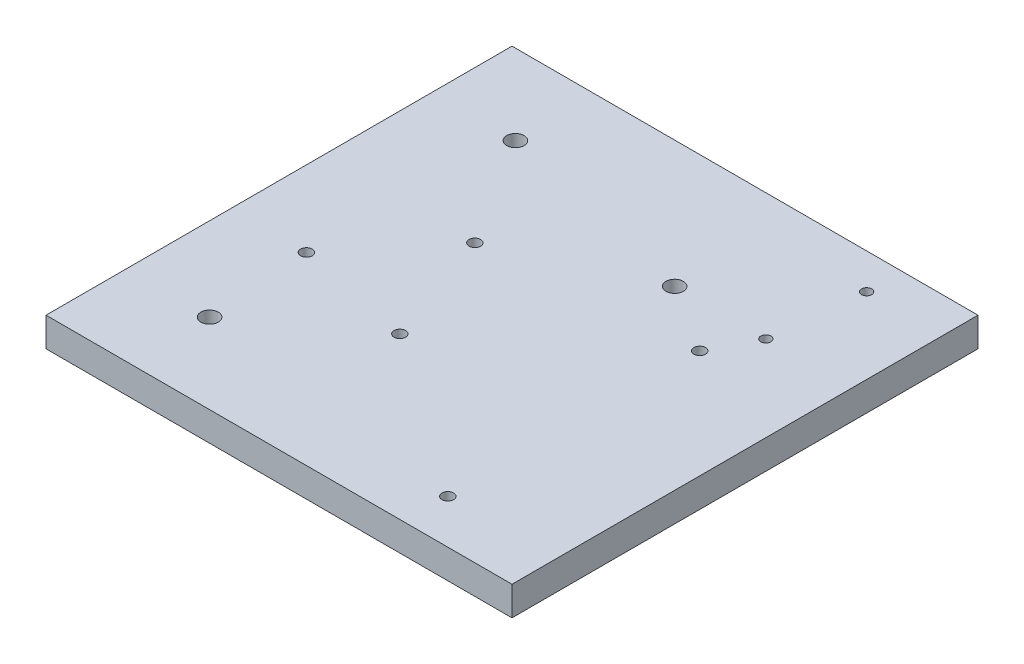
from build123d import *

# Parameters (mm, degrees)
SKETCH1_W           = 101.6
SKETCH1_H           = 101.6
BOSS_EXTRUDE1_DEPTH = 6.35
SKETCH3_R           = 1.27
CUT_EXTRUDE2_DEPTH  = 73.122135992
SKETCH4_R           = 1.27
CUT_EXTRUDE3_DEPTH  = 73.122135992
SKETCH7_R           = 1.89865
CUT_EXTRUDE5_DEPTH  = 73.122135992
SKETCH8_R           = 1.89865
CUT_EXTRUDE6_DEPTH  = 73.122135992
SKETCH10_R          = 1.1
CUT_EXTRUDE7_DEPTH  = 73.122135992


with BuildPart() as part:
    # Sketch1 → Boss-Extrude1 (new body)
    with BuildSketch(Plane(origin=(0, 0, 0), x_dir=(1, 0, 0), z_dir=(0, 1, 0))):
        Rectangle(SKETCH1_W, SKETCH1_H)
    extrude(amount=BOSS_EXTRUDE1_DEPTH)

    # Sketch3 → Cut-Extrude2 (cut, through all)
    with BuildSketch(Plane.XZ):
        with Locations((-8.691546024, 15.75616758)):
            Circle(SKETCH3_R)
        with Locations((-34.262562923, 10.563822948)):
            Circle(SKETCH3_R)
        with Locations((-17.714931052, -9.610745883)):
            Circle(SKETCH3_R)
    extrude(amount=-CUT_EXTRUDE2_DEPTH, mode=Mode.SUBTRACT)

    # Sketch4 → Cut-Extrude3 (cut, through all)
    with BuildSketch(Plane.XZ):
        with Locations((27.2, 41.198822948)):
            Circle(SKETCH4_R)
        with Locations((27.2, -13.721177052)):
            Circle(SKETCH4_R)
    extrude(amount=-CUT_EXTRUDE3_DEPTH, mode=Mode.SUBTRACT)

    # Sketch7 → Cut-Extrude5 (cut, through all)
    with BuildSketch(Plane.XZ):
        with Locations((-32.600738686, -33.3375)):
            Circle(SKETCH7_R)
        with Locations((-32.600738686, 33.3375)):
            Circle(SKETCH7_R)
    extrude(amount=-CUT_EXTRUDE5_DEPTH, mode=Mode.SUBTRACT)

    # Sketch8 → Cut-Extrude6 (cut, through all)
    with BuildSketch(Plane(origin=(0, 6.35, 0), x_dir=(1, 0, 0), z_dir=(0, 1, 0))):
        with Locations((12.280738686, 23.1775)):
            Circle(SKETCH8_R)
    extrude(amount=-CUT_EXTRUDE6_DEPTH, mode=Mode.SUBTRACT)

    # Sketch10 → Cut-Extrude7 (cut, through all)
    with BuildSketch(Plane(origin=(0, 6.35, 0), x_dir=(1, 0, 0), z_dir=(0, 1, 0))):
        with Locations((34.238748138, 43.081855351)):
            Circle(SKETCH10_R)
        with Locations((32.148178872, 23.191417444)):
            Circle(SKETCH10_R)
    extrude(amount=-CUT_EXTRUDE7_DEPTH, mode=Mode.SUBTRACT)


solid = part.part
